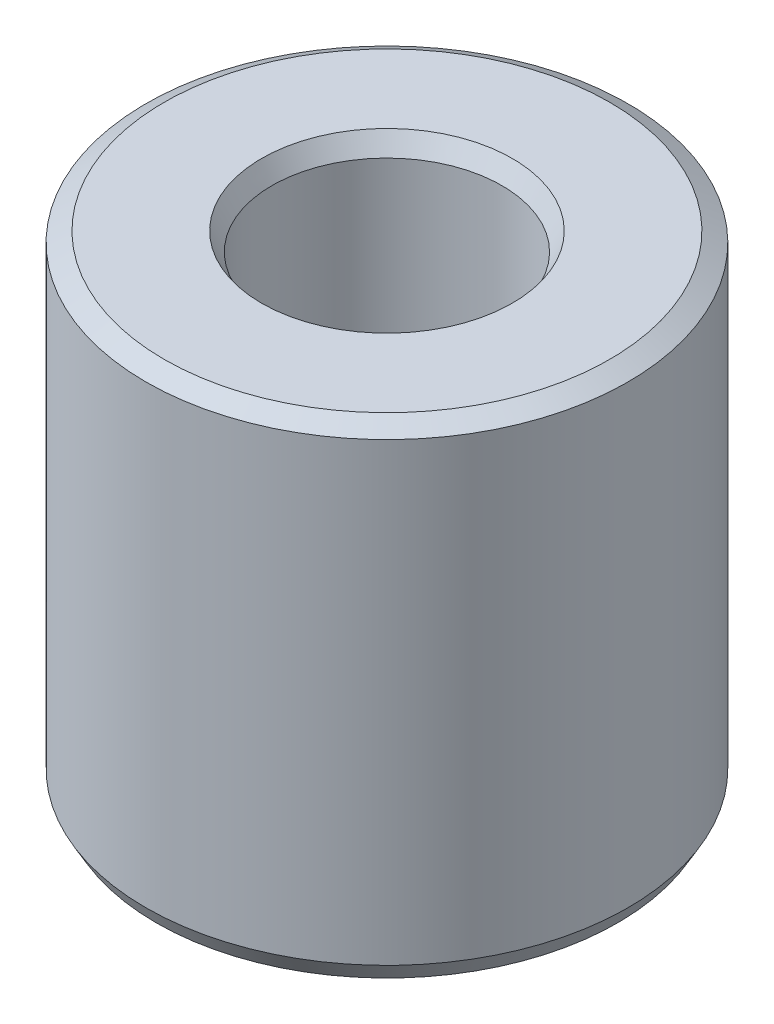
from build123d import *
from OCP.BRepFilletAPI import BRepFilletAPI_MakeChamfer

# Parameters (mm, degrees)
SKETCH1_R           = 22.5
BOSS_EXTRUDE1_DEPTH = 45.180158536
SKETCH2_R           = 10.735892343
CUT_EXTRUDE1_DEPTH  = 56.260715932
CHAMFER1_SIZE       = 0.968766148
CHAMFER1_SIZE2      = 1.708518143


with BuildPart() as part:
    # Sketch1 → Boss-Extrude1 (new body)
    with BuildSketch(Plane(origin=(0, 0, 0), x_dir=(1, 0, 0), z_dir=(0, 1, 0))):
        Circle(SKETCH1_R)
    extrude(amount=BOSS_EXTRUDE1_DEPTH)

    # Sketch2 → Cut-Extrude1 (cut, through all)
    with BuildSketch(Plane(origin=(0, 0, 0), x_dir=(1, 0, 0), z_dir=(0, 1, 0))):
        Circle(SKETCH2_R)
    extrude(amount=CUT_EXTRUDE1_DEPTH, mode=Mode.SUBTRACT)

    # Chamfer1: one chamfer whose edges measure the first distance from different faces: ONE call of the kernel's chamfer builder (chamfer() names one face for all edges)
    chamfer1_edges_1 = [part.edges().sort_by_distance(p)[0] for p in [
        (-10.735892343, 45.180158536, 0),
    ]]
    chamfer1_side_1 = [part.faces().sort_by_distance(p)[0] for p in [
        (-21.863603897, 45.180158536, 0),
    ]]
    chamfer1_edges_2 = [part.edges().sort_by_distance(p)[0] for p in [
        (-10.735892343, 0, 0),
    ]]
    chamfer1_side_2 = [part.faces().sort_by_distance(p)[0] for p in [
        (-10.735892343, 22.590079268, 0),
    ]]
    chamfer1_edges_3 = [part.edges().sort_by_distance(p)[0] for p in [
        (-22.5, 0, 0),
    ]]
    chamfer1_side_3 = [part.faces().sort_by_distance(p)[0] for p in [
        (-21.863603897, 0, 0),
    ]]
    chamfer1_edges_4 = [part.edges().sort_by_distance(p)[0] for p in [
        (-22.5, 45.180158536, 0),
    ]]
    chamfer1_side_4 = [part.faces().sort_by_distance(p)[0] for p in [
        (-22.5, 22.590079268, 0),
    ]]
    chamfer1 = BRepFilletAPI_MakeChamfer(part.part.solid().wrapped)
    for e in chamfer1_edges_1:
        chamfer1.Add(CHAMFER1_SIZE, CHAMFER1_SIZE2, e.wrapped, chamfer1_side_1[0].wrapped)  # the first distance lies on this face
    for e in chamfer1_edges_2:
        chamfer1.Add(CHAMFER1_SIZE, CHAMFER1_SIZE2, e.wrapped, chamfer1_side_2[0].wrapped)  # the first distance lies on this face
    for e in chamfer1_edges_3:
        chamfer1.Add(CHAMFER1_SIZE, CHAMFER1_SIZE2, e.wrapped, chamfer1_side_3[0].wrapped)  # the first distance lies on this face
    for e in chamfer1_edges_4:
        chamfer1.Add(CHAMFER1_SIZE, CHAMFER1_SIZE2, e.wrapped, chamfer1_side_4[0].wrapped)  # the first distance lies on this face
    add(Compound.cast(chamfer1.Shape()), mode=Mode.REPLACE)


solid = part.part
